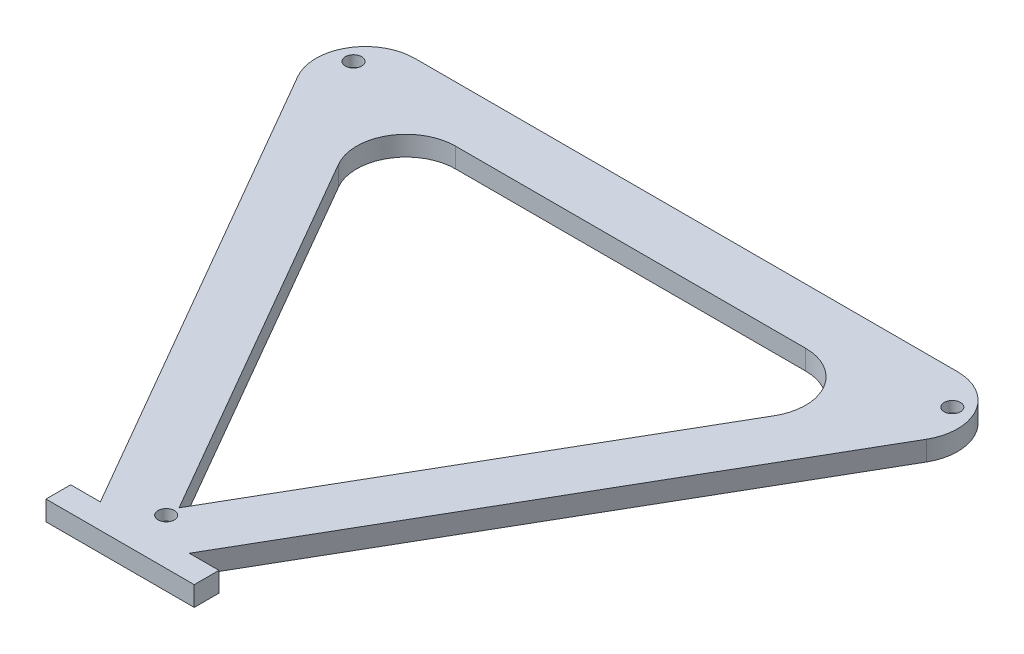
from build123d import *

# Parameters (mm, degrees)
BOSS_EXTRUDE1_DEPTH = 4
SKETCH2_R           = 1.65
CUT_EXTRUDE1_DEPTH  = 2.2


with BuildPart() as part:
    # Sketch1 → Boss-Extrude1 (new body)
    with BuildSketch(Plane(origin=(0, 0, 0), x_dir=(1, 0, 0), z_dir=(0, 1, 0))):
        with BuildLine():
            Line((-50.552239004, -73.99659536), (-105.141984966, 20.555618219))
            ThreePointArc((-105.141984966, 20.555618219), (-106.481730928, 25.555618219), (-105.141984966, 30.555618219))
            ThreePointArc((-105.141984966, 30.555618219), (-101.481730928, 34.215872257), (-96.481730928, 35.555618219))
            Line((-96.481730928, 35.555618219), (13.37725292, 35.555618219))
            ThreePointArc((13.37725292, 35.555618219), (18.37725292, 34.215872257), (22.037506958, 30.555618219))
            ThreePointArc((22.037506958, 30.555618219), (23.37725292, 25.555618219), (22.037506958, 20.555618219))
            Line((22.037506958, 20.555618219), (-32.552239004, -73.99659536))
            Line((-32.552239004, -73.99659536), (-26.552239004, -73.99659536))
            Line((-26.552239004, -73.99659536), (-26.552239004, -78.99659536))
            Line((-26.552239004, -78.99659536), (-36.552239004, -78.99659536))
            Line((-36.552239004, -78.99659536), (-46.552239004, -78.99659536))
            Line((-46.552239004, -78.99659536), (-56.552239004, -78.99659536))
            Line((-56.552239004, -78.99659536), (-56.552239004, -73.99659536))
            Line((-56.552239004, -73.99659536), (-50.552239004, -73.99659536))
        make_face()
        with BuildLine():
            Line((2.537506958, 9.29728797), (-41.552239004, -67.068392129))
            Line((-41.552239004, -67.068392129), (-85.641984966, 9.29728797))
            ThreePointArc((-85.641984966, 9.29728797), (-86.981730928, 14.29728797), (-85.641984966, 19.29728797))
            ThreePointArc((-85.641984966, 19.29728797), (-81.981730928, 22.957542008), (-76.981730928, 24.29728797))
            Line((-76.981730928, 24.29728797), (-6.12274708, 24.29728797))
            ThreePointArc((-6.12274708, 24.29728797), (-1.12274708, 22.957542008), (2.537506958, 19.29728797))
            ThreePointArc((2.537506958, 19.29728797), (3.87725292, 14.29728797), (2.537506958, 9.29728797))
        make_face(mode=Mode.SUBTRACT)
    extrude(amount=BOSS_EXTRUDE1_DEPTH)

    # Sketch2 → Cut-Extrude1 (cut)
    with BuildSketch(Plane(origin=(0, 4, 0), x_dir=(1, 0, 0), z_dir=(0, 1, 0))):
        with Locations((-41.552239004, -69.666468341)):
            Circle(SKETCH2_R)
        with Locations((-102.141984966, 28.823567412)):
            Circle(SKETCH2_R)
        with Locations((19.037506958, 28.823567412)):
            Circle(SKETCH2_R)
    extrude(amount=-CUT_EXTRUDE1_DEPTH, mode=Mode.SUBTRACT)


solid = part.part
